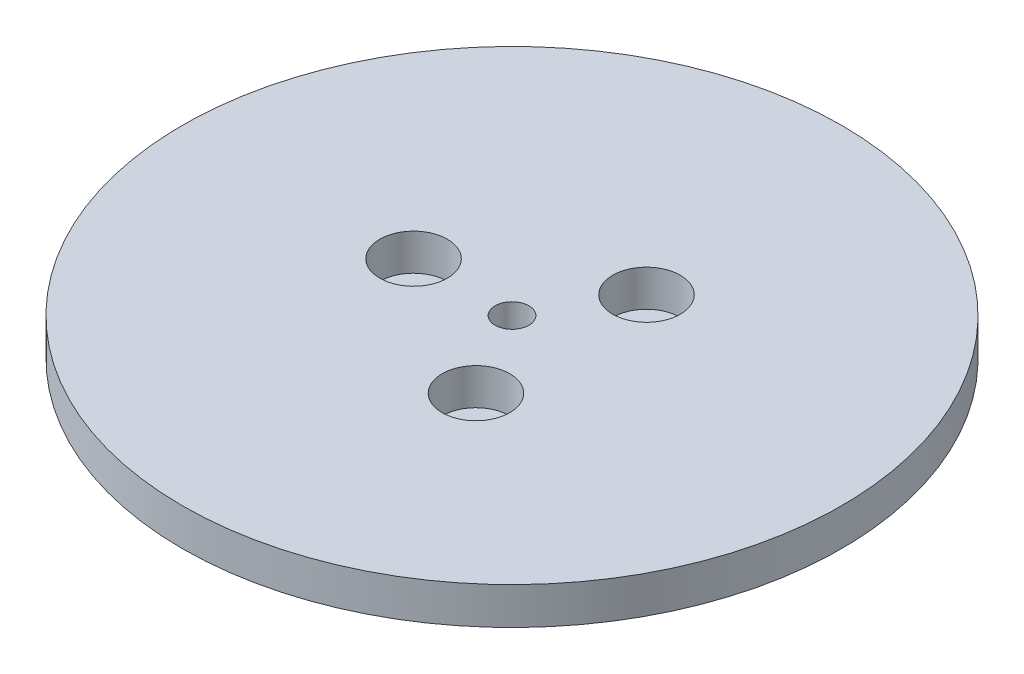
from build123d import *

# Parameters (mm, degrees)
SKETCH1_R           = 97.5
BOSS_EXTRUDE1_DEPTH = 11
SKETCH2_R           = 5
CUT_EXTRUDE1_DEPTH  = 139.32389526
SKETCH3_R           = 10
CUT_EXTRUDE2_DEPTH  = 10.790119951
CIRPATTERN1_COUNT   = 3


with BuildPart() as part:
    # Sketch1 → Boss-Extrude1 (new body)
    with BuildSketch(Plane(origin=(0, 0, 0), x_dir=(1, 0, 0), z_dir=(0, 1, 0))):
        Circle(SKETCH1_R)
    extrude(amount=BOSS_EXTRUDE1_DEPTH)

    # Sketch2 → Cut-Extrude1 (cut, through all)
    with BuildSketch(Plane(origin=(0, 0, 0), x_dir=(1, 0, 0), z_dir=(0, 1, 0))):
        Circle(SKETCH2_R)
    extrude(amount=CUT_EXTRUDE1_DEPTH, mode=Mode.SUBTRACT)

    # Sketch3 → Cut-Extrude2 (cut)
    with BuildSketch(Plane(origin=(0, 11, 0), x_dir=(1, 0, 0), z_dir=(0, 1, 0))):
        with Locations((-29.128115583, 0)):
            Circle(SKETCH3_R)
    cut_extrude2 = extrude(amount=-CUT_EXTRUDE2_DEPTH, mode=Mode.SUBTRACT)

    # CirPattern1: Cut-Extrude2 ×3 about axis
    cirpattern1_axis = Axis((0, 0, 0), (0, 1, 0))
    for i in range(1, CIRPATTERN1_COUNT):
        add(cut_extrude2.rotate(cirpattern1_axis, i * 360 / CIRPATTERN1_COUNT), mode=Mode.SUBTRACT)


solid = part.part
